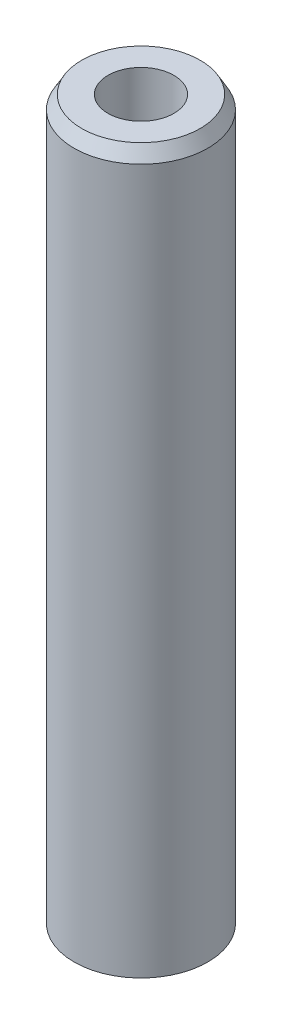
from build123d import *
from OCP.BRepFilletAPI import BRepFilletAPI_MakeChamfer

# Parameters (mm, degrees)
SKETCH1_R           = 30
BOSS_EXTRUDE1_DEPTH = 325.511131329
SKETCH2_R           = 14.793632746
CUT_EXTRUDE1_DEPTH  = 329.264370011
CHAMFER1_SIZE       = 5.953284032
CHAMFER1_SIZE2      = 3.437130138


with BuildPart() as part:
    # Sketch1 → Boss-Extrude1 (new body)
    with BuildSketch(Plane(origin=(0, 0, 0), x_dir=(1, 0, 0), z_dir=(0, 1, 0))):
        Circle(SKETCH1_R)
    extrude(amount=BOSS_EXTRUDE1_DEPTH)

    # Sketch2 → Cut-Extrude1 (cut, through all)
    with BuildSketch(Plane(origin=(0, 0, 0), x_dir=(1, 0, 0), z_dir=(0, 1, 0))):
        Circle(SKETCH2_R)
    extrude(amount=CUT_EXTRUDE1_DEPTH, mode=Mode.SUBTRACT)

    # Chamfer1: one chamfer whose edges measure the first distance from different faces: ONE call of the kernel's chamfer builder (chamfer() names one face for all edges)
    chamfer1_edges_1 = [part.edges().sort_by_distance(p)[0] for p in [
        (-30, 325.511131329, 0),
    ]]
    chamfer1_side_1 = [part.faces().sort_by_distance(p)[0] for p in [
        (-30, 162.755565664, 0),
    ]]
    chamfer1_edges_2 = [part.edges().sort_by_distance(p)[0] for p in [
        (-30, 0, 0),
    ]]
    chamfer1_side_2 = [part.faces().sort_by_distance(p)[0] for p in [
        (-29.151471863, 0, 0),
    ]]
    chamfer1 = BRepFilletAPI_MakeChamfer(part.part.solid().wrapped)
    for e in chamfer1_edges_1:
        chamfer1.Add(CHAMFER1_SIZE, CHAMFER1_SIZE2, e.wrapped, chamfer1_side_1[0].wrapped)  # the first distance lies on this face
    for e in chamfer1_edges_2:
        chamfer1.Add(CHAMFER1_SIZE, CHAMFER1_SIZE2, e.wrapped, chamfer1_side_2[0].wrapped)  # the first distance lies on this face
    add(Compound.cast(chamfer1.Shape()), mode=Mode.REPLACE)


solid = part.part
